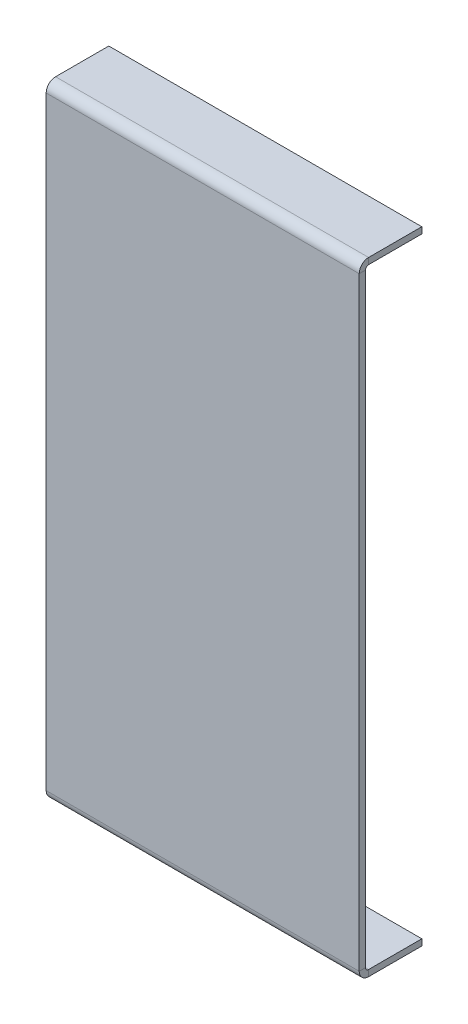
from build123d import *

# Parameters (mm, degrees)
SKETCH_1_W                         = 100
SKETCH_1_H                         = 199
SM_BASE_FLANGE_1_DEPTH             = 2
SM_EDGE_FLANGE_1_STRIP_W           = 10
SM_EDGE_FLANGE_1_STRIP_H           = 2
SM_EDGE_FLANGE_1_STRIP_CUT_DEPTH   = 100
SM_EDGE_FLANGE_1_STRIP_2_W         = 10
SM_EDGE_FLANGE_1_STRIP_2_H         = 2
SM_EDGE_FLANGE_1_STRIP_CUT_2_DEPTH = 100
SM_EDGE_FLANGE_1_DEPTH             = 100
SM_EDGE_FLANGE_1_BEND_DEPTH        = 100


# Sheet-metal steps are written as plain solids
with BuildPart() as part:
    # Sketch 1 → 基体-法兰1 (new body)
    with BuildSketch(Plane.XY):
        Rectangle(SKETCH_1_W, SKETCH_1_H)
    extrude(amount=-SM_BASE_FLANGE_1_DEPTH)

    # 边线-法兰1 strip (across the edge) → 边线-法兰1 strip cut (cut)
    with BuildSketch(Plane(origin=(-50, 99.5, -2), x_dir=(0, -1, 0), z_dir=(1, 0, 0))):
        with Locations((-2, -1)):
            Rectangle(SM_EDGE_FLANGE_1_STRIP_W, SM_EDGE_FLANGE_1_STRIP_H)
    extrude(amount=SM_EDGE_FLANGE_1_STRIP_CUT_DEPTH, mode=Mode.SUBTRACT)

    # 边线-法兰1 strip 2 (across the edge) → 边线-法兰1 strip cut 2 (cut)
    with BuildSketch(Plane(origin=(50, -99.5, -2), x_dir=(0, 1, 0), z_dir=(-1, 0, 0))):
        with Locations((-2, -1)):
            Rectangle(SM_EDGE_FLANGE_1_STRIP_2_W, SM_EDGE_FLANGE_1_STRIP_2_H)
    extrude(amount=SM_EDGE_FLANGE_1_STRIP_CUT_2_DEPTH, mode=Mode.SUBTRACT)

    # 边线-法兰1 section (across the edge) → 边线-法兰1 (add)
    with BuildSketch(Plane(origin=(-50, 99.5, -2), x_dir=(0, -1, 0), z_dir=(1, 0, 0))):
        with BuildLine():
            Line((0, 1), (0, 18))
            Line((0, 18), (2, 18))
            Line((2, 18), (2, 1))
            ThreePointArc((2, 1), (2.292893219, 0.292893219), (3, 0))
            Line((3, 0), (3, -2))
            ThreePointArc((3, -2), (0.878679656, -1.121320344), (0, 1))
        make_face()
    extrude(amount=SM_EDGE_FLANGE_1_DEPTH)

    # 边线-法兰1 section 2 (across the edge) → 边线-法兰1 bend (add)
    with BuildSketch(Plane(origin=(50, -99.5, -2), x_dir=(0, 1, 0), z_dir=(-1, 0, 0))):
        with BuildLine():
            Line((0, 1), (0, 18))
            Line((0, 18), (2, 18))
            Line((2, 18), (2, 1))
            ThreePointArc((2, 1), (2.292893219, 0.292893219), (3, 0))
            Line((3, 0), (3, -2))
            ThreePointArc((3, -2), (0.878679656, -1.121320344), (0, 1))
        make_face()
    extrude(amount=SM_EDGE_FLANGE_1_BEND_DEPTH)


solid = part.part
